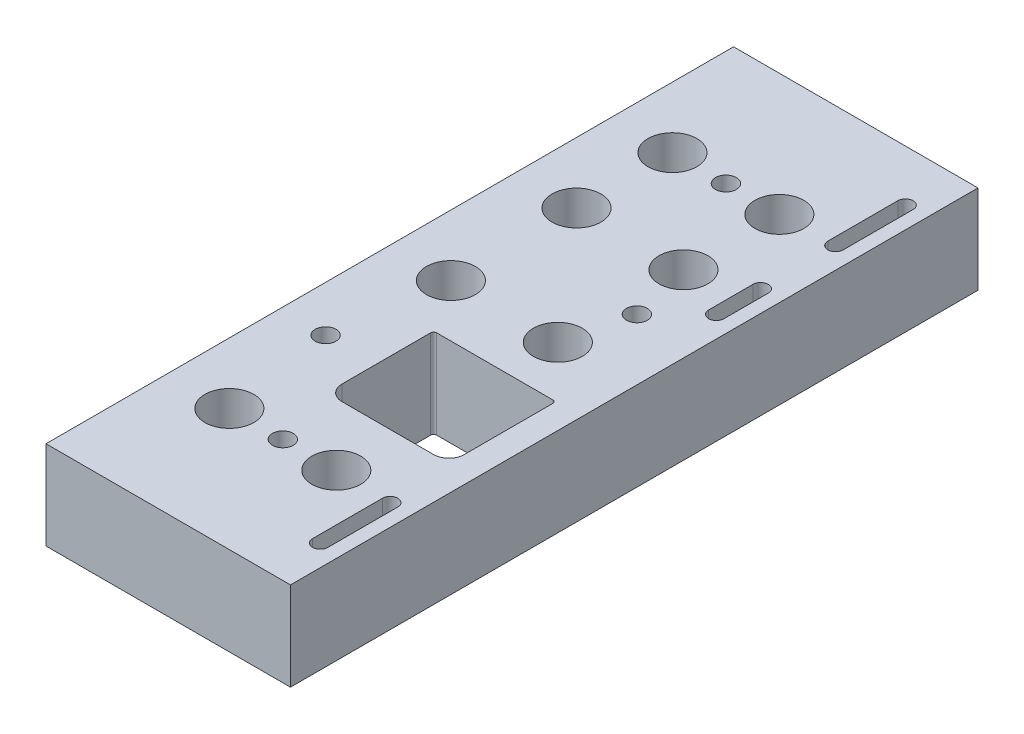
from build123d import *

# Parameters (mm, degrees)
SKETCH1_W             = 80
SKETCH1_H             = 225
BOSS_EXTRUDE1_DEPTH   = 29
CUT_EXTRUDE1_REACH    = 124.871
SKETCH3_R             = 8
CUT_EXTRUDE2_DEPTH    = 20
M8_TAPPED_HOLE1_D     = 6.8
M8_TAPPED_HOLE1_DEPTH = 19.75
M8_TAPPED_HOLE1_TIP   = 2.042926105


with BuildPart() as part:
    # Sketch1 → Boss-Extrude1 (new body)
    with BuildSketch(Plane(origin=(0, 0, 0), x_dir=(1, 0, 0), z_dir=(0, 1, 0))):
        Rectangle(SKETCH1_W, SKETCH1_H)
    extrude(amount=-BOSS_EXTRUDE1_DEPTH)

    # Sketch2 → Cut-Extrude1 (cut, up to next)
    with BuildSketch(Plane(origin=(0, 0, 0), x_dir=(1, 0, 0), z_dir=(0, 1, 0)), mode=Mode.PRIVATE) as cut_extrude1_sk1:
        with BuildLine():
            Line((30.5, 72.87), (30.5, 95.77))
            ThreePointArc((30.5, 95.77), (33, 98.27), (35.5, 95.77))
            Line((35.5, 95.77), (35.5, 72.87))
            ThreePointArc((35.5, 72.87), (33, 70.37), (30.5, 72.87))
        make_face()
    cut_extrude1_tool1 = extrude(cut_extrude1_sk1.sketch, amount=-CUT_EXTRUDE1_REACH, mode=Mode.PRIVATE) & part.part
    # Sketch2 → Cut-Extrude1 (cut, up to next)
    with BuildSketch(Plane(origin=(0, 0, 0), x_dir=(1, 0, 0), z_dir=(0, 1, 0)), mode=Mode.PRIVATE) as cut_extrude1_sk2:
        with BuildLine():
            Line((30.5, 33.86), (30.5, 48.36))
            ThreePointArc((30.5, 48.36), (33, 50.86), (35.5, 48.36))
            Line((35.5, 48.36), (35.5, 33.86))
            ThreePointArc((35.5, 33.86), (33, 31.36), (30.5, 33.86))
        make_face()
    cut_extrude1_tool2 = extrude(cut_extrude1_sk2.sketch, amount=-CUT_EXTRUDE1_REACH, mode=Mode.PRIVATE) & part.part
    # Sketch2 → Cut-Extrude1 (cut, up to next)
    with BuildSketch(Plane(origin=(0, 0, 0), x_dir=(1, 0, 0), z_dir=(0, 1, 0)), mode=Mode.PRIVATE) as cut_extrude1_sk3:
        with BuildLine():
            Line((31.5, -47.14), (31.5, -18.14))
            ThreePointArc((31.5, -18.14), (31.207106781, -17.432893219), (30.5, -17.14))
            Line((30.5, -17.14), (-7.5, -17.14))
            ThreePointArc((-7.5, -17.14), (-8.207106781, -17.432893219), (-8.5, -18.14))
            Line((-8.5, -18.14), (-8.5, -47.14))
            ThreePointArc((-8.5, -47.14), (-7.035533906, -50.675533906), (-3.5, -52.14))
            Line((-3.5, -52.14), (26.5, -52.14))
            ThreePointArc((26.5, -52.14), (30.035533906, -50.675533906), (31.5, -47.14))
        make_face()
    cut_extrude1_tool3 = extrude(cut_extrude1_sk3.sketch, amount=-CUT_EXTRUDE1_REACH, mode=Mode.PRIVATE) & part.part
    # Sketch2 → Cut-Extrude1 (cut, up to next)
    with BuildSketch(Plane(origin=(0, 0, 0), x_dir=(1, 0, 0), z_dir=(0, 1, 0)), mode=Mode.PRIVATE) as cut_extrude1_sk4:
        with BuildLine():
            Line((30.5, -95.77), (30.5, -72.87))
            ThreePointArc((30.5, -72.87), (33, -70.37), (35.5, -72.87))
            Line((35.5, -72.87), (35.5, -95.77))
            ThreePointArc((35.5, -95.77), (33, -98.27), (30.5, -95.77))
        make_face()
    cut_extrude1_tool4 = extrude(cut_extrude1_sk4.sketch, amount=-CUT_EXTRUDE1_REACH, mode=Mode.PRIVATE) & part.part
    add(cut_extrude1_tool1.solids().sort_by_distance((33, 0, -84.32))[0], mode=Mode.SUBTRACT)
    add(cut_extrude1_tool2.solids().sort_by_distance((33, 0, -41.11))[0], mode=Mode.SUBTRACT)
    add(cut_extrude1_tool3.solids().sort_by_distance((11.5, 0, 34.518764))[0], mode=Mode.SUBTRACT)
    add(cut_extrude1_tool4.solids().sort_by_distance((33, 0, 84.32))[0], mode=Mode.SUBTRACT)

    # Sketch3 → Cut-Extrude2 (cut)
    with BuildSketch(Plane(origin=(0, 0, 0), x_dir=(1, 0, 0), z_dir=(0, 1, 0))):
        with Locations((15, 72.5)):
            Circle(SKETCH3_R)
        with Locations((15, 41.11)):
            Circle(SKETCH3_R)
        with Locations((15, 0)):
            Circle(SKETCH3_R)
        with Locations((15, -72.5)):
            Circle(SKETCH3_R)
        with Locations((-20, -72.5)):
            Circle(SKETCH3_R)
        with Locations((-20, 0)):
            Circle(SKETCH3_R)
        with Locations((-20, 41.11)):
            Circle(SKETCH3_R)
        with Locations((-20, 72.5)):
            Circle(SKETCH3_R)
    extrude(amount=-CUT_EXTRUDE2_DEPTH, mode=Mode.SUBTRACT)

    # M8 Tapped Hole1
    with Locations(Plane(origin=(0, 0, 0), x_dir=(1, 0, 0), z_dir=(0, 1, 0))):
        with Locations((-25, -36), (20, 20.863945448), (-2.5, 72.5), (-2.5, -72.5)):
            Hole(M8_TAPPED_HOLE1_D / 2, depth=M8_TAPPED_HOLE1_DEPTH)
            with Locations((0, 0, -(M8_TAPPED_HOLE1_DEPTH + M8_TAPPED_HOLE1_TIP / 2))):  # 118° drill point
                Cone(0, M8_TAPPED_HOLE1_D / 2, M8_TAPPED_HOLE1_TIP, mode=Mode.SUBTRACT)


solid = part.part
